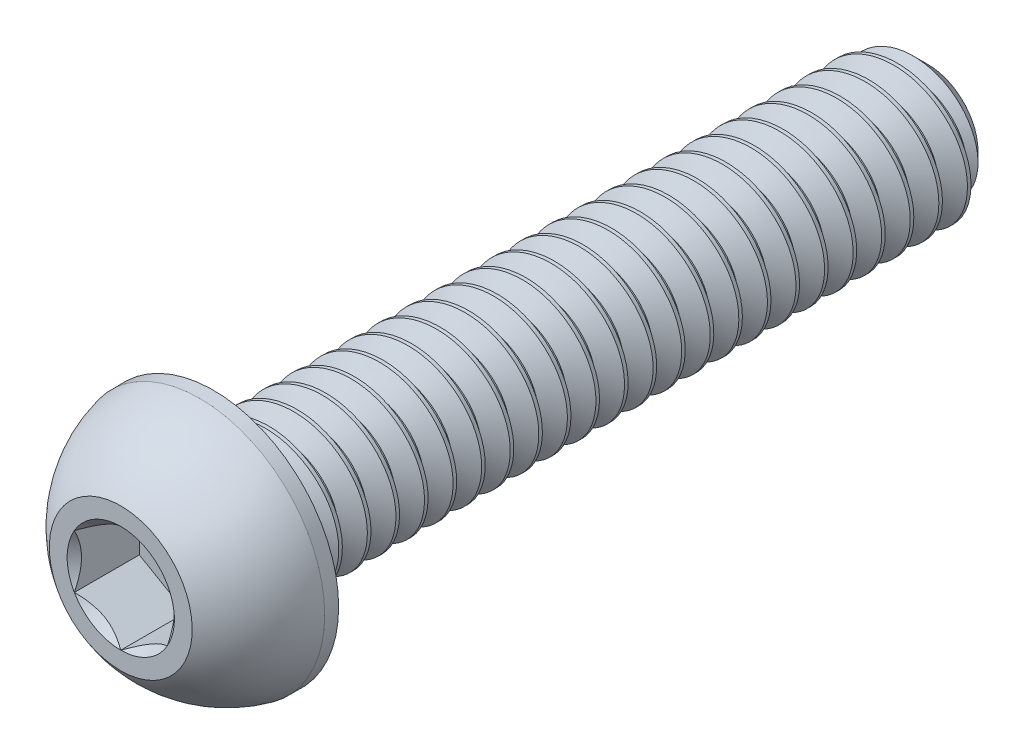
from build123d import *

# Parameters (mm, degrees)
SKETCH1_W          = 10
SKETCH1_H          = 1
CHAMFER1_SIZE      = 0.3
CUT_SWEEP1_PITCH   = 0.4
CUT_EXTRUDE2_DEPTH = 0.91


with BuildPart() as part:
    # Sketch1 → Revolve1 (revolve)
    with BuildSketch(Plane(origin=(0, 0, 0), x_dir=(0, 0, -1), z_dir=(1, 0, 0))):
        with Locations((6.3, 0.5)):
            Rectangle(SKETCH1_W, SKETCH1_H)
    revolve(axis=Axis((0, 0, -11.3), (0, 0, 1)))

    # Chamfer1
    chamfer1_edges = [part.edges().sort_by_distance(p)[0] for p in [
        (0, -1, -11.3),
    ]]
    chamfer(chamfer1_edges, length=CHAMFER1_SIZE)

    # Cut-Sweep1: arcs per turn and ends read off the stored shape
    # Cut-Sweep1: the profile of Sketch2 profile screwed along a right-hand helix through 26 turns, 6 arcs to a turn; built about Z, then put on its axis
    cut_sweep1_z = Axis((0, 0, 0), (0, 0, 1))
    cut_sweep1_corners = [(1.000300031, 3.49e-07, 0.000173203), (1.000300031, 3.49e-07, -0.350173207), (0.74019241, 2.58e-07, -0.200000002), (0.74019241, 2.58e-07, -0.150000002)]
    with BuildLine(mode=Mode.PRIVATE) as cut_sweep1_profile:
        Line(cut_sweep1_corners[0], cut_sweep1_corners[1])
        Line(cut_sweep1_corners[1], cut_sweep1_corners[2])
        Line(cut_sweep1_corners[2], cut_sweep1_corners[3])
        Line(cut_sweep1_corners[3], cut_sweep1_corners[0])
    cut_sweep1_cap = Face(cut_sweep1_profile.wire())
    cut_sweep1_turn_angles = [0, 30, 60, 90, 120, 150, 180, 210, 240, 270, 300, 330, 360]
    cut_sweep1_turn_weights = [1, 0.8660254037844387, 1, 0.8660254037844387, 1, 0.8660254037844387, 1, 0.8660254037844387, 1, 0.8660254037844387, 1, 0.8660254037844387, 1]
    cut_sweep1_turn_rails = [Edge.make_bspline([Vector(p[0], p[1], 0).rotate(cut_sweep1_z, cut_sweep1_turn_angles[k]) / cut_sweep1_turn_weights[k] + Vector(0, 0, p[2] + CUT_SWEEP1_PITCH * cut_sweep1_turn_angles[k] / 360) for k in range(13)], [0, 0, 0, 1, 1, 2, 2, 3, 3, 4, 4, 5, 5, 6, 6, 6], 2, cut_sweep1_turn_weights) for p in cut_sweep1_corners]
    cut_sweep1_turn_sides = [Face.make_surface_from_curves(cut_sweep1_turn_rails[p[0]], cut_sweep1_turn_rails[p[1]]) for p in [(0, 1), (1, 2), (2, 3), (3, 0)]]
    cut_sweep1 = Plane(origin=(0, 0, -11.3), x_dir=(1, 0, 0), z_dir=(0, 0, 1)) * Solid(Shell([*[p.moved(Location((0, 0, CUT_SWEEP1_PITCH * i))) for i in range(26) for p in cut_sweep1_turn_sides], cut_sweep1_cap, cut_sweep1_cap.rotate(cut_sweep1_z, 9360).moved(Location((0, 0, CUT_SWEEP1_PITCH * 9360 / 360)))]))
    add(cut_sweep1, mode=Mode.SUBTRACT)

    # Sketch7 → Revolve2 (revolve)
    with BuildSketch(Plane(origin=(0, 0, 0), x_dir=(0, 0, -1), z_dir=(1, 0, 0)), mode=Mode.PRIVATE) as revolve2_sk:
        with BuildLine():
            Line((1.105, 1.75), (1.3, 1.75))
            Line((1.3, 1.75), (1.3, 0))
            Line((1.3, 0), (0, 0))
            Line((0, 0), (0, 1))
            ThreePointArc((0, 1), (0.479976957, 1.481850617), (1.105, 1.75))
        make_face()
    revolve(revolve2_sk.sketch.rotate(Axis((0, 0, 0), (0, 0, -1)), 180), axis=Axis((0, 0, 0), (0, 0, -1)))

    # Sketch5 → Cut-Extrude2 (cut)
    with BuildSketch(Plane.XY):
        Polygon((0.65, -0.375277675), (0.65, 0.375277675), (0, 0.75055535), (-0.65, 0.375277675), (-0.65, -0.375277675), (0, -0.75055535), align=None)
    extrude(amount=-CUT_EXTRUDE2_DEPTH, mode=Mode.SUBTRACT)

    # Cut-Extrude3 cone 1 section (through the dimple's axis) → Cut-Extrude3 (revolve, cut)
    with BuildSketch(Plane(origin=(0, 0, 0), x_dir=(0, -1, 0), z_dir=(1, 0, 0))):
        Polygon((0, 0), (0.75055535, 0), (0, 0.75055535), align=None)
    revolve(axis=Axis((0, 0, 0), (0, 0, -1)), mode=Mode.SUBTRACT)


solid = part.part
